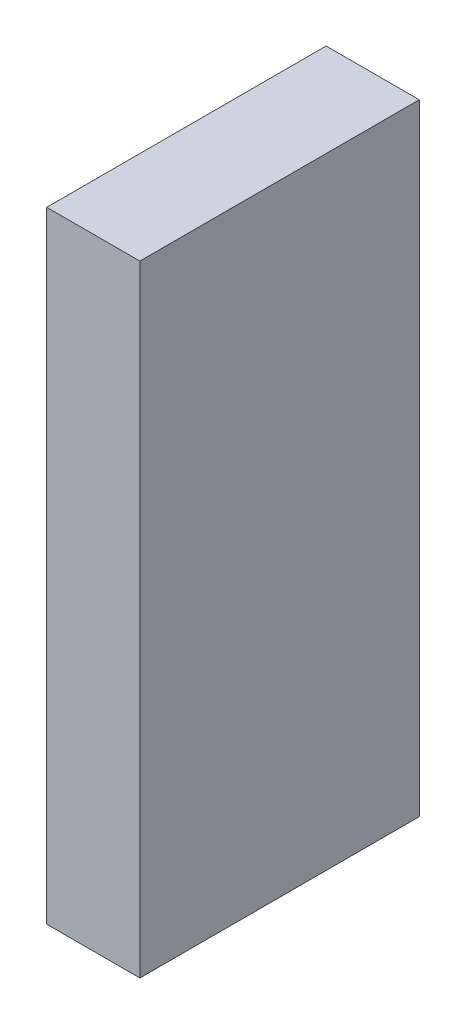
from build123d import *

# Parameters (mm, degrees)
SKETCH1_W           = 30
SKETCH1_H           = 90
BOSS_EXTRUDE1_DEPTH = 100


with BuildPart() as part:
    # Sketch1 → Boss-Extrude1 (new, symmetric)
    with BuildSketch(Plane(origin=(0, 0, 0), x_dir=(1, 0, 0), z_dir=(0, 1, 0))):
        Rectangle(SKETCH1_W, SKETCH1_H)
    extrude(amount=BOSS_EXTRUDE1_DEPTH, both=True)


solid = part.part
